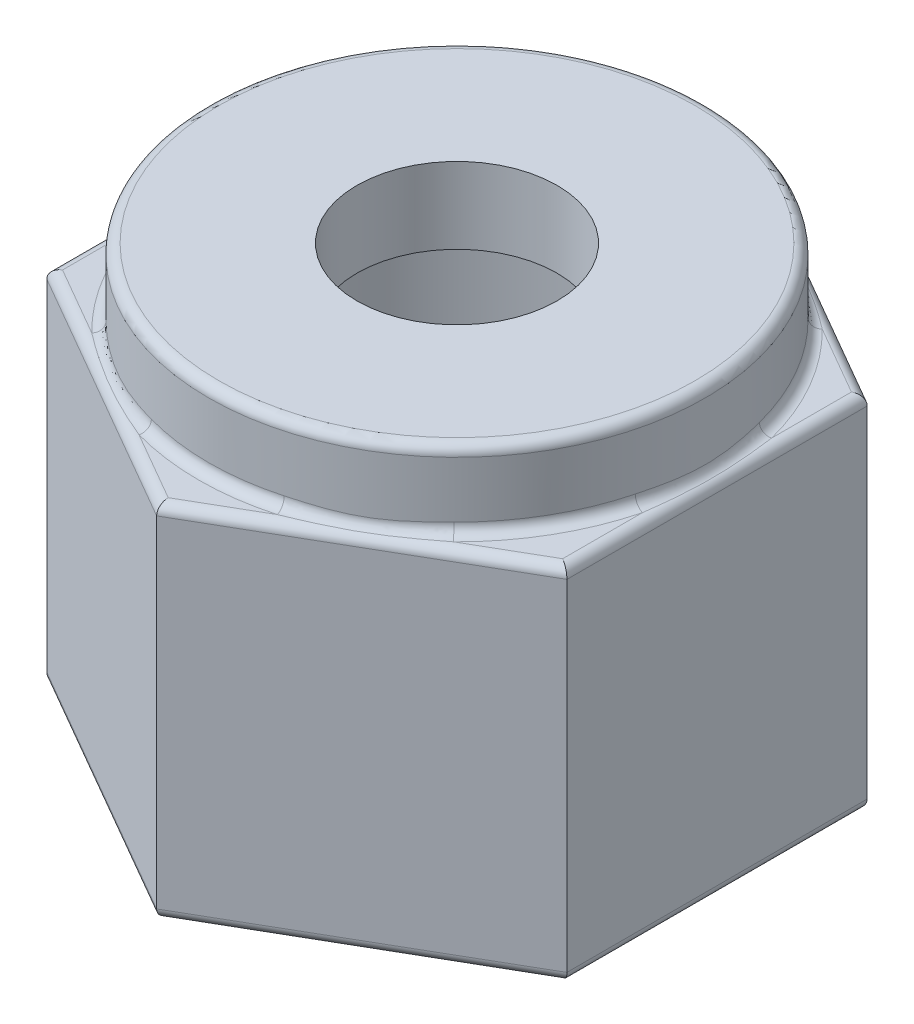
from build123d import *

# Parameters (mm, degrees)
SKETCH_3_R          = 10.188
CUT_EXTRUDE_1_DEPTH = 27.790856821
SKETCH_5_R          = 12.4
SKETCH_4_R          = 12.4
SKETCH_6_R          = 5
CUT_EXTRUDE_2_DEPTH = 30.478636501
FILLET_1_R          = 0.5
FILLET_2_R          = 0.5
FILLET_3_R          = 0.5


with BuildPart() as part:
    # Эскиз2 → По сечениям1 section 0
    with BuildSketch(Plane(origin=(0, -18, 0), x_dir=(1, 0, 0), z_dir=(0, 1, 0))):
        with BuildLine():
            Line((-12.990381057, -7.5), (0, -15))
            Line((0, -15), (12.990381057, -7.5))
            Line((12.990381057, -7.5), (12.990381057, 7.5))
            Line((12.990381057, 7.5), (0, 15))
            Line((0, 15), (-12.990381057, 7.5))
            Line((-12.990381057, 7.5), (-12.990381057, -7.5))
        make_face()
    # Эскиз1 → По сечениям1 section 1
    with BuildSketch(Plane(origin=(0, 0, 0), x_dir=(1, 0, 0), z_dir=(0, 1, 0))):
        with BuildLine():
            Line((0, 15), (-12.990381057, 7.5))
            Line((-12.990381057, 7.5), (-12.990381057, -7.5))
            Line((-12.990381057, -7.5), (0, -15))
            Line((0, -15), (12.990381057, -7.5))
            Line((12.990381057, -7.5), (12.990381057, 7.5))
            Line((12.990381057, 7.5), (0, 15))
        make_face()
    loft()

    # Эскиз3 → Вырез-Вытянуть1 (cut, through all)
    with BuildSketch(Plane.XZ.offset(18)):
        Circle(SKETCH_3_R)
    extrude(amount=-CUT_EXTRUDE_1_DEPTH, mode=Mode.SUBTRACT)

    # Эскиз5 → По сечениям2 section 0
    with BuildSketch(Plane(origin=(0, 3.8, 0), x_dir=(1, 0, 0), z_dir=(0, 1, 0))):
        Circle(SKETCH_5_R)
    # Эскиз4 → По сечениям2 section 1
    with BuildSketch(Plane(origin=(0, 0, 0), x_dir=(1, 0, 0), z_dir=(0, 1, 0))):
        Circle(SKETCH_4_R)
    loft()

    # Эскиз6 → Вырез-Вытянуть2 (cut, through all)
    with BuildSketch(Plane(origin=(0, 3.8, 0), x_dir=(1, 0, 0), z_dir=(0, 1, 0))):
        Circle(SKETCH_6_R)
    extrude(amount=-CUT_EXTRUDE_2_DEPTH, mode=Mode.SUBTRACT)

    # Скругление1
    fillet_1_edges = [part.edges().sort_by_distance(p)[0] for p in [
        (-12.4, 3.8, 0),
    ]]
    fillet(fillet_1_edges, radius=FILLET_1_R)

    # Скругление2
    fillet_2_edges = [part.edges().sort_by_distance(p)[0] for p in [
        (-6.495190528, -18, 11.25),
        (6.495190528, -18, 11.25),
        (-12.990381057, -18, 0),
        (-6.495190528, -18, -11.25),
        (12.990381057, -18, 0),
        (6.495190528, -18, -11.25),
        (6.495190528, 0, -11.25),
        (-6.495190528, 0, -11.25),
        (-12.990381057, 0, 0),
        (-6.495190528, 0, 11.25),
        (12.990381057, 0, 0),
        (6.495190528, 0, 11.25),
    ]]
    fillet(fillet_2_edges, radius=FILLET_2_R)

    # Скругление3
    fillet_3_edges = [part.edges().sort_by_distance(p)[0] for p in [
        (-12.4, 0, 0),
    ]]
    fillet(fillet_3_edges, radius=FILLET_3_R)


solid = part.part
